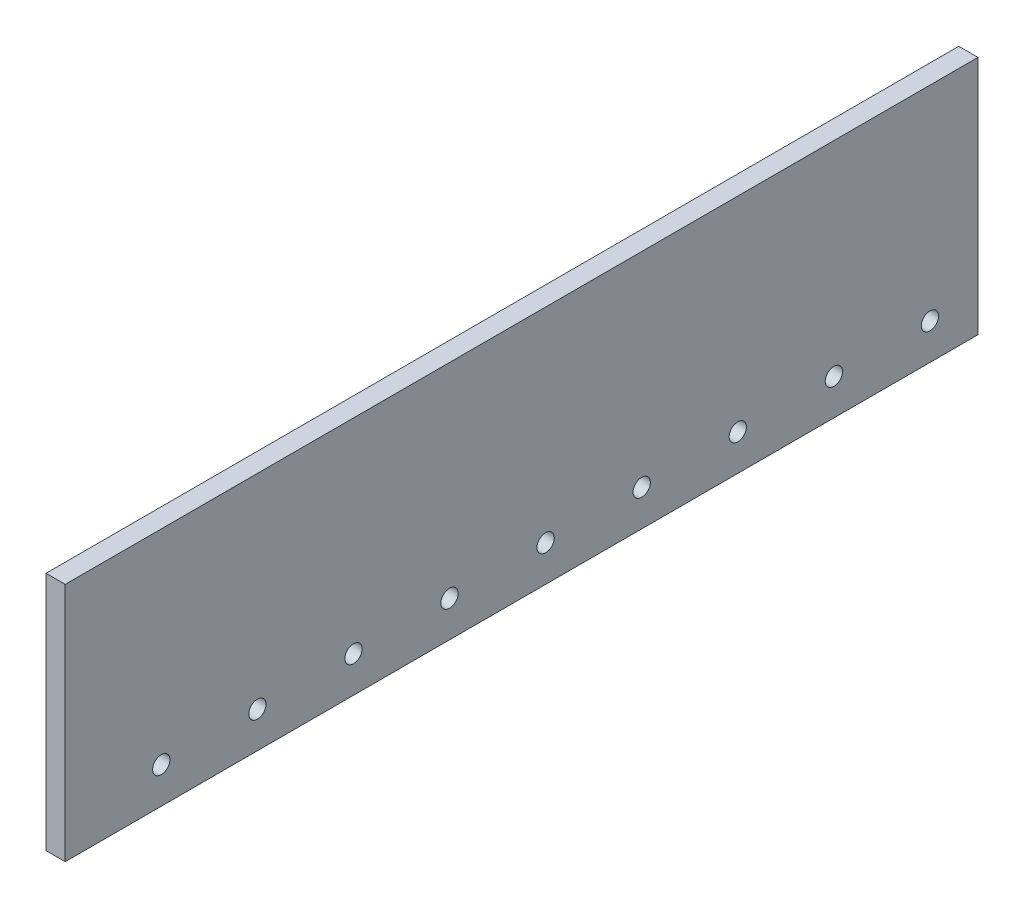
from build123d import *

# Parameters (mm, degrees)
SKETCH2_W           = 190
SKETCH2_H           = 50
SKETCH2_R           = 1.8
BOSS_EXTRUDE1_DEPTH = 4


with BuildPart() as part:
    # Sketch2 → Boss-Extrude1 (new body)
    with BuildSketch(Plane(origin=(0, 0, 0), x_dir=(0, 0, -1), z_dir=(1, 0, 0))):
        with Locations((10.740740741, 25.216049383)):
            Rectangle(SKETCH2_W, SKETCH2_H)
        with Locations((-64.259259259, 7.716049383)):
            Circle(SKETCH2_R, mode=Mode.SUBTRACT)
        with Locations((-44.259259259, 7.716049383)):
            Circle(SKETCH2_R, mode=Mode.SUBTRACT)
        with Locations((-24.259259259, 7.716049383)):
            Circle(SKETCH2_R, mode=Mode.SUBTRACT)
        with Locations((-4.259259259, 7.716049383)):
            Circle(SKETCH2_R, mode=Mode.SUBTRACT)
        with Locations((15.740740741, 7.716049383)):
            Circle(SKETCH2_R, mode=Mode.SUBTRACT)
        with Locations((35.740740741, 7.716049383)):
            Circle(SKETCH2_R, mode=Mode.SUBTRACT)
        with Locations((55.740740741, 7.716049383)):
            Circle(SKETCH2_R, mode=Mode.SUBTRACT)
        with Locations((75.740740741, 7.716049383)):
            Circle(SKETCH2_R, mode=Mode.SUBTRACT)
        with Locations((95.740740741, 7.716049383)):
            Circle(SKETCH2_R, mode=Mode.SUBTRACT)
    extrude(amount=BOSS_EXTRUDE1_DEPTH)


solid = part.part
